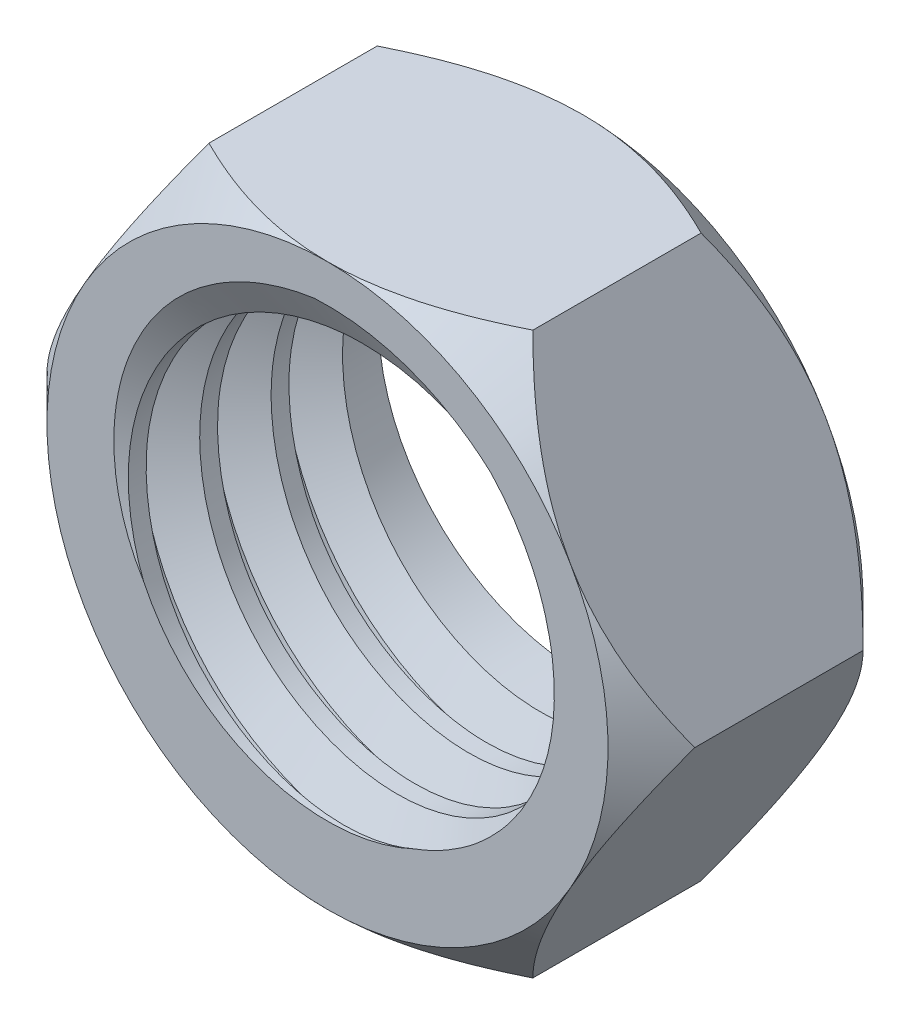
from build123d import *

# Parameters (mm, degrees)
BOSS_EXTRUDE1_DEPTH = 2.5
CUT_EXTRUDE1_REACH  = 6.888
SKETCH1_3_R         = 2
SKETCH1_4_OUTSIDE_W = 12.104
SKETCH1_4_OUTSIDE_H = 11.254
SKETCH1_4_OUTSIDE_R = 2.75
CUT_EXTRUDE2_DEPTH  = 1
CUT_EXTRUDE2_DRAFT  = 45
SKETCH2_OUTSIDE_W   = 12.104
SKETCH2_OUTSIDE_H   = 11.254
SKETCH2_OUTSIDE_R   = 2.75
CUT_EXTRUDE3_DEPTH  = 1
CUT_EXTRUDE3_DRAFT  = -45
THREAD1_PITCH       = 0.7


with BuildPart() as part:
    # Sketch1 → Boss-Extrude1 (new body)
    with BuildSketch(Plane.XY):
        Polygon((3.175426481, 0), (1.58771324, 2.75), (-1.58771324, 2.75), (-3.175426481, 0), (-1.58771324, -2.75), (1.58771324, -2.75), align=None)
    extrude(amount=BOSS_EXTRUDE1_DEPTH)

    # Sketch1<3> → Cut-Extrude1 (cut, up to next)
    with BuildSketch(Plane.XY, mode=Mode.PRIVATE) as cut_extrude1_sk1:
        Circle(SKETCH1_3_R)
    cut_extrude1_tool1 = extrude(cut_extrude1_sk1.sketch, amount=CUT_EXTRUDE1_REACH, mode=Mode.PRIVATE) & part.part
    add(cut_extrude1_tool1.solids().sort_by_distance((0, 0, 0))[0], mode=Mode.SUBTRACT)


with BuildPart() as cut_extrude2_tool:
    # Sketch1<4> outside → Cut-Extrude2 (with draft: the straight prism first)
    with BuildSketch(Plane.XY):
        Rectangle(SKETCH1_4_OUTSIDE_W, SKETCH1_4_OUTSIDE_H)
        Circle(SKETCH1_4_OUTSIDE_R, mode=Mode.SUBTRACT)
    extrude(amount=CUT_EXTRUDE2_DEPTH)
    # Cut-Extrude2: the draft: its side faces are tilted about the plane it starts from
    cut_extrude2_sides = [cut_extrude2_tool.faces().sort_by_distance(p)[0] for p in [
        (0, -5.627, 0.5),
        (6.052, 0, 0.5),
        (0, 5.627, 0.5),
        (-6.052, 0, 0.5),
        (-2.75, 0, 0.5),
    ]]
    draft(cut_extrude2_sides, Plane.XY, CUT_EXTRUDE2_DRAFT)


with BuildPart() as part_1:
    add(part.part)

    # Cut-Extrude2: cut by cut_extrude2_tool
    add(cut_extrude2_tool.part, mode=Mode.SUBTRACT)


with BuildPart() as cut_extrude3_tool:
    # Sketch2 outside → Cut-Extrude3 (with draft: the straight prism first)
    with BuildSketch(Plane.XY.offset(2.5)):
        Rectangle(SKETCH2_OUTSIDE_W, SKETCH2_OUTSIDE_H)
        Circle(SKETCH2_OUTSIDE_R, mode=Mode.SUBTRACT)
    extrude(amount=-CUT_EXTRUDE3_DEPTH)
    # Cut-Extrude3: the draft: its side faces are tilted about the plane it starts from
    cut_extrude3_sides = [cut_extrude3_tool.faces().sort_by_distance(p)[0] for p in [
        (0, -5.627, 2),
        (6.052, 0, 2),
        (0, 5.627, 2),
        (-6.052, 0, 2),
        (-2.75, 0, 2),
    ]]
    draft(cut_extrude3_sides, Plane.XY.offset(2.5), CUT_EXTRUDE3_DRAFT)


with BuildPart() as part_2:
    add(part_1.part)

    # Cut-Extrude3: cut by cut_extrude3_tool
    add(cut_extrude3_tool.part, mode=Mode.SUBTRACT)

    # Thread1: the profile of Thread Profile1 profile screwed along a right-hand helix of 3.571429 turns, 6 arcs to a turn; built about Z, then put on its axis
    thread1_z = Axis((0, 0, 0), (0, 0, 1))
    thread1_corners = [(1.9997, 0, -0.000173205), (2.378886113, 0, 0.218749999), (2.378886113, 0, 0.306249999), (1.9997, 0, 0.525173203)]
    with BuildLine(mode=Mode.PRIVATE) as thread1_profile:
        Line(thread1_corners[0], thread1_corners[1])
        Line(thread1_corners[1], thread1_corners[2])
        Line(thread1_corners[2], thread1_corners[3])
        Line(thread1_corners[3], thread1_corners[0])
    thread1_cap = Face(thread1_profile.wire())
    thread1_turn_angles = [0, 30, 60, 90, 120, 150, 180, 210, 240, 270, 300, 330, 360]
    thread1_turn_weights = [1, 0.8660254037844387, 1, 0.8660254037844387, 1, 0.8660254037844387, 1, 0.8660254037844387, 1, 0.8660254037844387, 1, 0.8660254037844387, 1]
    thread1_turn_rails = [Edge.make_bspline([Vector(p[0], p[1], 0).rotate(thread1_z, thread1_turn_angles[k]) / thread1_turn_weights[k] + Vector(0, 0, p[2] + THREAD1_PITCH * thread1_turn_angles[k] / 360) for k in range(13)], [0, 0, 0, 1, 1, 2, 2, 3, 3, 4, 4, 5, 5, 6, 6, 6], 2, thread1_turn_weights) for p in thread1_corners]
    thread1_turn_sides = [Face.make_surface_from_curves(thread1_turn_rails[p[0]], thread1_turn_rails[p[1]]) for p in [(0, 1), (1, 2), (2, 3), (3, 0)]]
    thread1_last_angles = [1080, 1110, 1140, 1170, 1200, 1230, 1260, 1272.857142857, 1285.714285714]
    thread1_last_weights = [1, 0.8660254037844387, 1, 0.8660254037844387, 1, 0.8660254037844387, 1, 0.9749279121818235, 1]
    thread1_last_rails = [Edge.make_bspline([Vector(p[0], p[1], 0).rotate(thread1_z, thread1_last_angles[k]) / thread1_last_weights[k] + Vector(0, 0, p[2] + THREAD1_PITCH * thread1_last_angles[k] / 360) for k in range(9)], [0, 0, 0, 1, 1, 2, 2, 3, 3, 4, 4, 4], 2, thread1_last_weights) for p in thread1_corners]
    thread1_last_sides = [Face.make_surface_from_curves(thread1_last_rails[p[0]], thread1_last_rails[p[1]]) for p in [(0, 1), (1, 2), (2, 3), (3, 0)]]
    thread1 = Plane(origin=(0, 0, 0), x_dir=(1, 0, 0), z_dir=(0, 0, 1)) * Solid(Shell([*[p.moved(Location((0, 0, THREAD1_PITCH * i))) for i in range(3) for p in thread1_turn_sides], *thread1_last_sides, thread1_cap, thread1_cap.rotate(thread1_z, 1285.714285714).moved(Location((0, 0, THREAD1_PITCH * 1285.714285714 / 360)))]))
    add(thread1, mode=Mode.SUBTRACT)


solid = part_2.part
